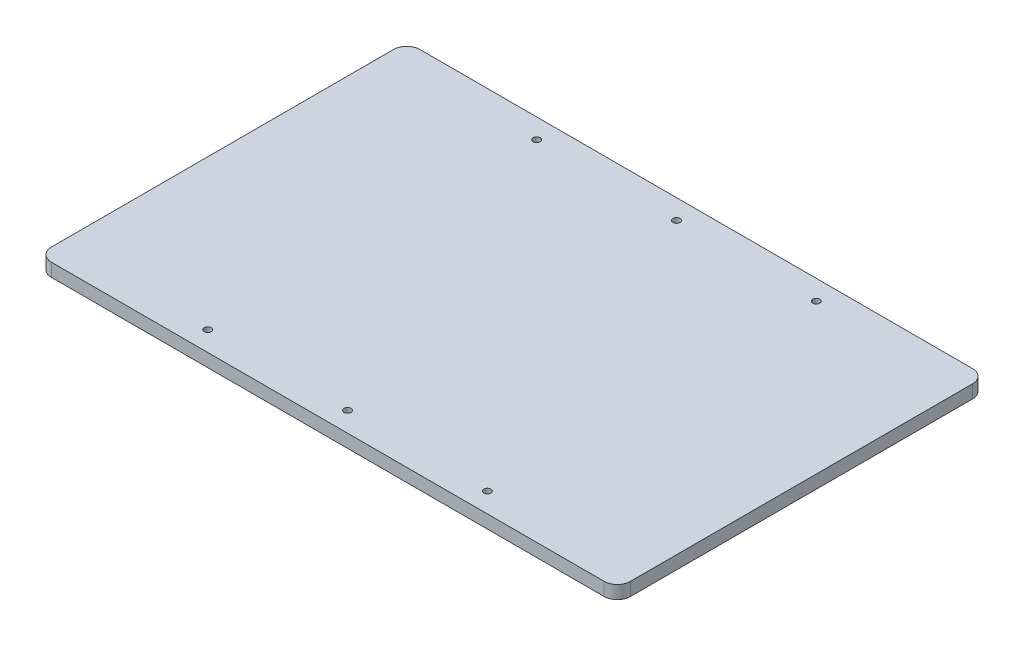
from build123d import *

# Parameters (mm, degrees)
SKETCH1_R           = 1.7
BOSS_EXTRUDE1_DEPTH = 6.35


with BuildPart() as part:
    # Sketch1 → Boss-Extrude1 (new body)
    with BuildSketch(Plane(origin=(0, 0, 0), x_dir=(1, 0, 0), z_dir=(0, 1, 0))):
        with BuildLine():
            Line((-133.35, 88.9), (133.35, 88.9))
            ThreePointArc((133.35, 88.9), (137.840128061, 87.040128061), (139.7, 82.55))
            Line((139.7, 82.55), (139.7, -82.55))
            ThreePointArc((139.7, -82.55), (137.840128061, -87.040128061), (133.35, -88.9))
            Line((133.35, -88.9), (-133.35, -88.9))
            ThreePointArc((-133.35, -88.9), (-137.840128061, -87.040128061), (-139.7, -82.55))
            Line((-139.7, -82.55), (-139.7, 82.55))
            ThreePointArc((-139.7, 82.55), (-137.840128061, 87.040128061), (-133.35, 88.9))
        make_face()
        with Locations((-67.46875, 79.375)):
            Circle(SKETCH1_R, mode=Mode.SUBTRACT)
        with Locations((0, 79.375)):
            Circle(SKETCH1_R, mode=Mode.SUBTRACT)
        with Locations((67.46875, 79.375)):
            Circle(SKETCH1_R, mode=Mode.SUBTRACT)
        with Locations((67.46875, -79.375)):
            Circle(SKETCH1_R, mode=Mode.SUBTRACT)
        with Locations((0, -79.375)):
            Circle(SKETCH1_R, mode=Mode.SUBTRACT)
        with Locations((-67.46875, -79.375)):
            Circle(SKETCH1_R, mode=Mode.SUBTRACT)
    extrude(amount=BOSS_EXTRUDE1_DEPTH)


solid = part.part
